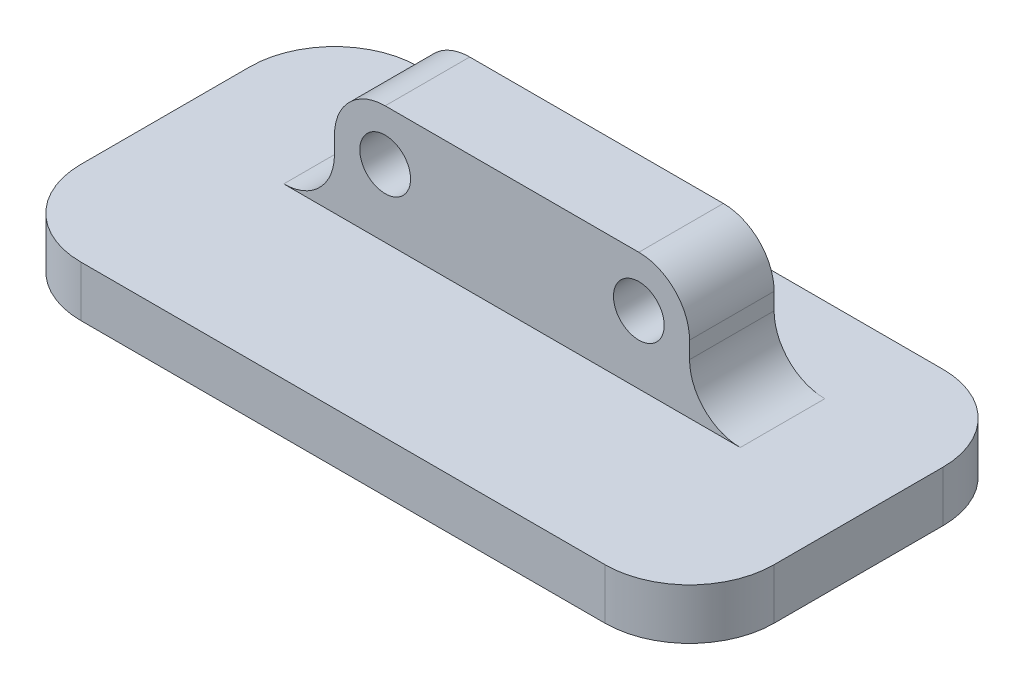
from build123d import *

# Parameters (mm, degrees)
SKETCH_1_R      = 1.5
EXTRUDE_1_DEPTH = 5
SKETCH_2_W      = 41
SKETCH_2_H      = 20
EXTRUDE_2_DEPTH = 3
FILLET_1_R      = 3
FILLET_2_R      = 5


with BuildPart() as part:
    # ｽｹｯﾁ1 → ﾎﾞｽ - 押し出し1 (new body)
    with BuildSketch(Plane.XY):
        with BuildLine():
            Line((-3, -4), (18, -4))
            Line((18, -4), (18, 0))
            ThreePointArc((18, 0), (17.121320344, 2.121320344), (15, 3))
            Line((15, 3), (0, 3))
            ThreePointArc((0, 3), (-2.121320344, 2.121320344), (-3, 0))
            Line((-3, 0), (-3, -4))
        make_face()
        Circle(SKETCH_1_R, mode=Mode.SUBTRACT)
        with Locations((15, 0)):
            Circle(SKETCH_1_R, mode=Mode.SUBTRACT)
    extrude(amount=EXTRUDE_1_DEPTH)

    # ｽｹｯﾁ2 → ﾎﾞｽ - 押し出し2 (add)
    with BuildSketch(Plane.XZ.offset(4)):
        with Locations((7.5, 5)):
            Rectangle(SKETCH_2_W, SKETCH_2_H)
    extrude(amount=EXTRUDE_2_DEPTH)

    # ﾌｨﾚｯﾄ1
    fillet_1_edges = [part.edges().sort_by_distance(p)[0] for p in [
        (-3, -4, 2.5),
        (18, -4, 2.5),
    ]]
    fillet(fillet_1_edges, radius=FILLET_1_R)

    # ﾌｨﾚｯﾄ2
    fillet_2_edges = [part.edges().sort_by_distance(p)[0] for p in [
        (-13, -5.5, 15),
        (-13, -5.5, -5),
        (28, -5.5, 15),
        (28, -5.5, -5),
    ]]
    fillet(fillet_2_edges, radius=FILLET_2_R)


solid = part.part
